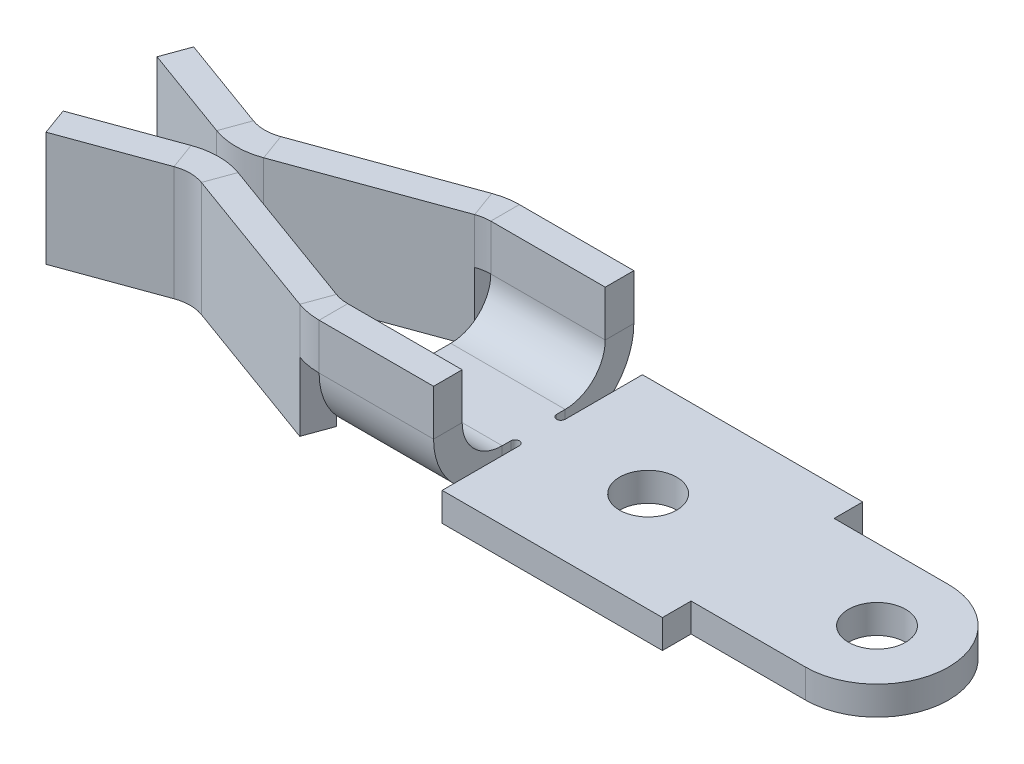
from build123d import *

# Parameters (mm, degrees)
SKETCH1_W                      = 6
SKETCH1_H                      = 3.5
BASE_DEPTH                     = 0.5
TAB_DEPTH                      = 0.5
SKETCH3_R                      = 0.5
SOLDERING_HOLE_DEPTH           = 7.509608283
SKETCH4_R                      = 0.5
RIVET_HOLE_DEPTH               = 7.509608283
FIRST_START                    = -3
FIRST_SIDE_TAB_DEPTH           = 2.15
FIRST_SIDE_TAB_2_DEPTH         = 2
FIRST_START_2                  = -1
FIRST_SIDE_TAB_3_DEPTH         = 2.2
SECOND_ANGLED_SIDE_TAB_DEPTH   = 2
SECOND_START                   = 1.2
SECOND_ANGLED_SIDE_TAB_2_DEPTH = 0.8
THIRD_ANGLED_SIDE_TAB_DEPTH    = 2
MIRROR1_DEPTH                  = 0.5
MIRROR1_2_OUTLINE_W            = 2
MIRROR1_2_OUTLINE_H            = 0.5
MIRROR1_2_DEPTH                = 0.04719
MIRROR1_3_DEPTH                = 2
MIRROR1_START                  = 1.2
MIRROR1_4_DEPTH                = 0.8
MIRROR1_START_2                = -3
MIRROR1_5_DEPTH                = 2
MIRROR1_6_DEPTH                = 2


with BuildPart() as part:
    # Sketch1 → BASE (new body)
    with BuildSketch(Plane(origin=(0, 0, 0), x_dir=(1, 0, 0), z_dir=(0, 1, 0))):
        Rectangle(SKETCH1_W, SKETCH1_H)
    extrude(amount=BASE_DEPTH)

    # Sketch2 → TAB (add)
    with BuildSketch(Plane(origin=(0, 0, 0), x_dir=(1, 0, 0), z_dir=(0, 1, 0))):
        with BuildLine():
            Line((5, -1.25), (3, -1.25))
            ThreePointArc((3, -1.25), (1.75, 0), (3, 1.25))
            Line((3, 1.25), (5, 1.25))
            ThreePointArc((5, 1.25), (6.25, 0), (5, -1.25))
        make_face()
    extrude(amount=TAB_DEPTH)

    # Sketch3 → SOLDERING HOLE (cut, through all)
    with BuildSketch(Plane(origin=(0, 0.5, 0), x_dir=(1, 0, 0), z_dir=(0, 1, 0))):
        with Locations(Location((5, 0, 0), (0, 0, 270))):
            Circle(SKETCH3_R)
    extrude(amount=-SOLDERING_HOLE_DEPTH, mode=Mode.SUBTRACT)

    # Sketch4 → RIVET HOLE (cut, through all)
    with BuildSketch(Plane(origin=(0, 0.5, 0), x_dir=(1, 0, 0), z_dir=(0, 1, 0))):
        with Locations(Location((1, 0, 0), (0, 0, 270))):
            Circle(SKETCH4_R)
    extrude(amount=-RIVET_HOLE_DEPTH, mode=Mode.SUBTRACT)

    # FIRST SIDE TAB: read off the stored shape, not the designer's step
    # FIRST SIDE TAB outline → FIRST SIDE TAB (cut)
    with BuildSketch(Plane.YZ.offset(FIRST_START)):
        with BuildLine():
            ThreePointArc((0, 0.55), (0.132292175, 1.097722557), (0.5, 1.524679434))
            Line((0.5, 1.524679434), (0.5, 1.75))
            Line((0.5, 1.75), (0, 1.75))
            Line((0, 1.75), (0, 0.55))
        make_face()
    extrude(amount=FIRST_SIDE_TAB_DEPTH, mode=Mode.SUBTRACT)

    # FIRST SIDE TAB 2 outline → FIRST SIDE TAB 2 (add)
    with BuildSketch(Plane.YZ.offset(FIRST_START)):
        with BuildLine():
            Line((2, 1.75), (1.2, 1.75))
            ThreePointArc((1.2, 1.75), (0.832314891, 1.692281778), (0.5, 1.524679434))
            Line((0.5, 1.524679434), (0.5, 0.55))
            ThreePointArc((0.5, 0.55), (0.705025253, 1.044974747), (1.2, 1.25))
            Line((1.2, 1.25), (2, 1.25))
            Line((2, 1.25), (2, 1.75))
        make_face()
    extrude(amount=FIRST_SIDE_TAB_2_DEPTH)

    # FIRST SIDE TAB 3 outline → FIRST SIDE TAB 3 (cut)
    with BuildSketch(Plane(origin=(0, 0, 0), x_dir=(1, 0, 0), z_dir=(0, 1, 0)).offset(FIRST_START_2)):
        with BuildLine():
            Line((-0.85, -3), (-0.85, -0.4))
            ThreePointArc((-0.85, -0.4), (-0.925, -0.325), (-1, -0.4))
            Line((-1, -0.4), (-1, -3))
            Line((-1, -3), (-0.85, -3))
        make_face()
    extrude(amount=FIRST_SIDE_TAB_3_DEPTH, mode=Mode.SUBTRACT)



with BuildPart() as body_2:
    # SECOND ANGLED SIDE TAB: read off the stored shape, not the designer's step
    # SECOND ANGLED SIDE TAB outline → SECOND ANGLED SIDE TAB (new body)
    with BuildSketch(Plane(origin=(0, 0, 0), x_dir=(1, 0, 0), z_dir=(0, 1, 0))):
        Polygon((-6.113516821, -0.69378588), (-3.410424172, -1.677631145), (-3.2394141, -1.207784835), (-5.942506749, -0.22393957), align=None)
    extrude(amount=SECOND_ANGLED_SIDE_TAB_DEPTH)


with BuildPart() as part_1:
    add(part.part)

    add(body_2.part)  # SECOND ANGLED SIDE TAB 2 merges body 2
    # SECOND ANGLED SIDE TAB 2 outline → SECOND ANGLED SIDE TAB 2 (add)
    with BuildSketch(Plane(origin=(0, 0, 0), x_dir=(1, 0, 0), z_dir=(0, 1, 0)).offset(SECOND_START)):
        with BuildLine():
            Line((-3.2394141, -1.207784835), (-3.410424172, -1.677631145))
            ThreePointArc((-3.410424172, -1.677631145), (-3.208377813, -1.731769304), (-3, -1.75))
            Line((-3, -1.75), (-3, -1.25))
            ThreePointArc((-3, -1.25), (-3.121553724, -1.239365427), (-3.2394141, -1.207784835))
        make_face()
    extrude(amount=SECOND_ANGLED_SIDE_TAB_2_DEPTH)

    # THIRD ANGLED SIDE TAB: sheet metal written as solids
    # THIRD ANGLED SIDE TAB section (on a plane across the edge) → THIRD ANGLED SIDE TAB (add)
    with BuildSketch(Plane(origin=(-6.352930921, 2, 0.606646274), x_dir=(0.3420201433256691, 0, 0.9396926207859083), z_dir=(0, -1, 0))):
        with BuildLine():
            Line((-0.5, 0.254779164), (-0.5, 2))
            Line((-0.5, 2), (0, 2))
            Line((0, 2), (0, 0.254779164))
            ThreePointArc((0, 0.254779164), (0.042215165, 0.015365064), (0.16376889, -0.195172163))
            Line((0.16376889, -0.195172163), (-0.219253332, -0.516565968))
            ThreePointArc((-0.219253332, -0.516565968), (-0.427631145, -0.155645008), (-0.5, 0.254779164))
        make_face()
    extrude(amount=THIRD_ANGLED_SIDE_TAB_DEPTH)

    # Mirror1: read off the stored shape, not the designer's step
    # Mirror1 outline → Mirror1 (cut)
    with BuildSketch(Plane(origin=(0, 0, 0), x_dir=(1, 0, 0), z_dir=(0, 1, 0))):
        with BuildLine():
            Line((-0.85, 1.75), (-1, 1.75))
            Line((-1, 1.75), (-1, 0.4))
            ThreePointArc((-1, 0.4), (-0.925, 0.325), (-0.85, 0.4))
            Line((-0.85, 0.4), (-0.85, 1.75))
        make_face()
    extrude(amount=MIRROR1_DEPTH, mode=Mode.SUBTRACT)

    # Mirror1 2 outline → Mirror1 2 (cut)
    with BuildSketch(Plane(origin=(0, 0, 0), x_dir=(1, 0, 0), z_dir=(0, 1, 0))):
        with Locations((-2, 1.5)):
            Rectangle(MIRROR1_2_OUTLINE_W, MIRROR1_2_OUTLINE_H)
    extrude(amount=MIRROR1_2_DEPTH, mode=Mode.SUBTRACT)

    # Mirror1 5 outline → Mirror1 5 (cut)
    with BuildSketch(Plane.YZ.offset(MIRROR1_START_2)):
        with BuildLine():
            Line((0.5, -1.75), (0.5, -1.524679434))
            ThreePointArc((0.5, -1.524679434), (0.132292175, -1.097722557), (0, -0.55))
            Line((0, -0.55), (0, -1.25))
            Line((0, -1.25), (0.04719, -1.25))
            Line((0.04719, -1.25), (0.04719, -1.75))
            Line((0.04719, -1.75), (0.5, -1.75))
        make_face()
    extrude(amount=MIRROR1_5_DEPTH, mode=Mode.SUBTRACT)



with BuildPart() as body_2_2:
    # Mirror1 3 outline → Mirror1 3 (new body)
    with BuildSketch(Plane(origin=(0, 0, 0), x_dir=(1, 0, 0), z_dir=(0, 1, 0))):
        with BuildLine():
            Line((-3.2394141, 1.207784835), (-3.410424172, 1.677631145))
            Line((-3.410424172, 1.677631145), (-6.113516821, 0.69378588))
            ThreePointArc((-6.113516821, 0.69378588), (-6.352930921, 0.651570715), (-6.592345021, 0.69378588))
            Line((-6.592345021, 0.69378588), (-8.232316162, 1.290686561))
            Line((-8.232316162, 1.290686561), (-8.403326234, 0.82084025))
            Line((-8.403326234, 0.82084025), (-6.763355093, 0.22393957))
            ThreePointArc((-6.763355093, 0.22393957), (-6.352930921, 0.151570715), (-5.942506749, 0.22393957))
            Line((-5.942506749, 0.22393957), (-3.2394141, 1.207784835))
        make_face()
    extrude(amount=MIRROR1_3_DEPTH)

    # Mirror1 4 outline → Mirror1 4 (add)
    with BuildSketch(Plane(origin=(0, 0, 0), x_dir=(1, 0, 0), z_dir=(0, 1, 0)).offset(MIRROR1_START)):
        with BuildLine():
            Line((-1, 1.75), (-3, 1.75))
            ThreePointArc((-3, 1.75), (-3.208377813, 1.731769304), (-3.410424172, 1.677631145))
            Line((-3.410424172, 1.677631145), (-3.2394141, 1.207784835))
            ThreePointArc((-3.2394141, 1.207784835), (-3.121553724, 1.239365427), (-3, 1.25))
            Line((-3, 1.25), (-1, 1.25))
            Line((-1, 1.25), (-1, 1.75))
        make_face()
    extrude(amount=MIRROR1_4_DEPTH)


with BuildPart() as part_2:
    add(part_1.part)

    add(body_2_2.part)  # Mirror1 6 merges body 2 2
    # Mirror1 6 outline → Mirror1 6 (add)
    with BuildSketch(Plane.YZ.offset(MIRROR1_START_2)):
        with BuildLine():
            ThreePointArc((0.5, -1.524679434), (0.832314891, -1.692281778), (1.2, -1.75))
            Line((1.2, -1.75), (1.2, -1.25))
            ThreePointArc((1.2, -1.25), (0.705025253, -1.044974747), (0.5, -0.55))
            Line((0.5, -0.55), (0.5, -1.524679434))
        make_face()
    extrude(amount=MIRROR1_6_DEPTH)


solid = part_2.part
